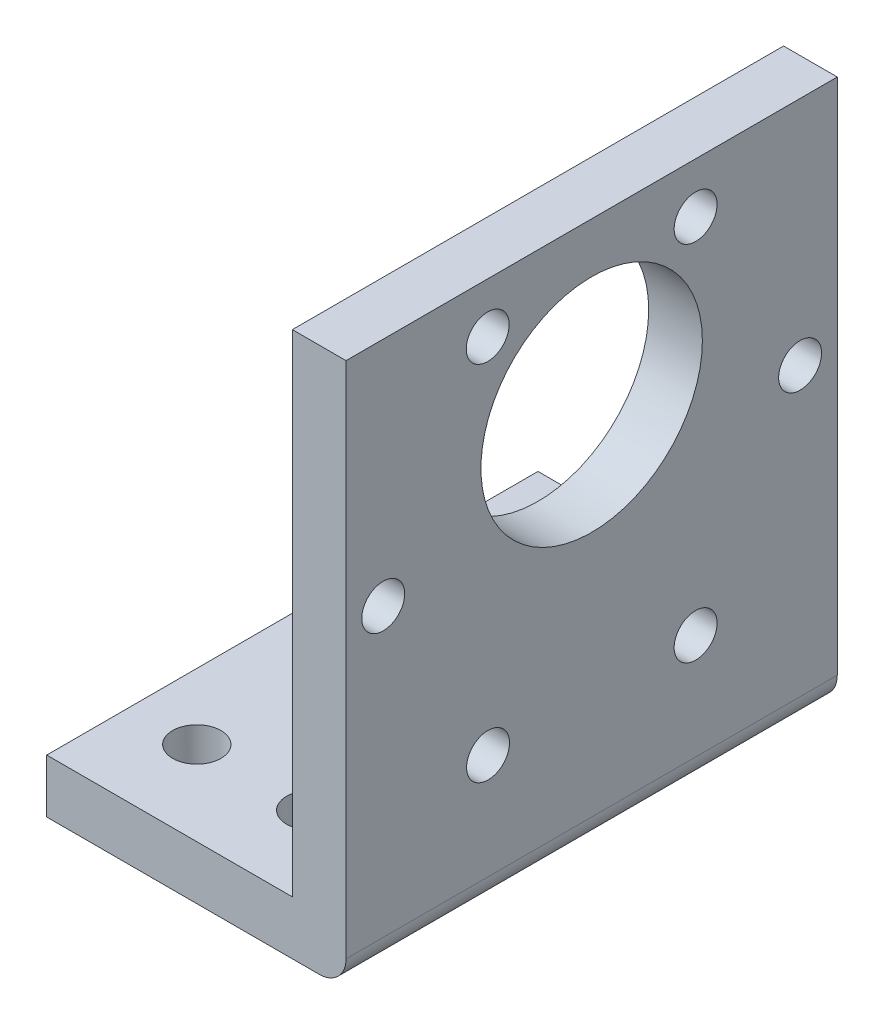
from build123d import *

# Parameters (mm, degrees)
SKETCH_1_W          = 22.3
SKETCH_1_H          = 36.6
EXTRUDE_1_DEPTH     = 40.6
SKETCH_2_W          = 18.3
SKETCH_2_H          = 36.6
CUT_EXTRUDE_1_DEPTH = 36.6
SKETCH_3_R          = 8.25
SKETCH_3_R_2        = 1.6
CUT_EXTRUDE_5_DEPTH = 36.6
SKETCH_4_R          = 1.8
CUT_EXTRUDE_7_DEPTH = 36.6
FILLET_1_R          = 2


with BuildPart() as part:
    # 草图1 → 凸台-拉伸1 (new body)
    with BuildSketch(Plane(origin=(0, 0, 0), x_dir=(1, 0, 0), z_dir=(0, 1, 0))):
        Rectangle(SKETCH_1_W, SKETCH_1_H)
    extrude(amount=EXTRUDE_1_DEPTH)

    # 草图2 → 切除-拉伸1 (cut)
    with BuildSketch(Plane(origin=(0, 40.6, 0), x_dir=(1, 0, 0), z_dir=(0, 1, 0))):
        with Locations((-2, 0)):
            Rectangle(SKETCH_2_W, SKETCH_2_H)
    extrude(amount=-CUT_EXTRUDE_1_DEPTH, mode=Mode.SUBTRACT)

    # 草图3 → 切除-拉伸5 (cut)
    with BuildSketch(Plane(origin=(11.15, 0, 0), x_dir=(0, 0, -1), z_dir=(1, 0, 0))):
        with Locations((0, 28.613666333)):
            Circle(SKETCH_3_R)
        with Locations((-7.745235234, 36.863666333)):
            Circle(SKETCH_3_R_2)
        with Locations((7.745235234, 36.863666333)):
            Circle(SKETCH_3_R_2)
        with Locations((-15.529977583, 23.38009706)):
            Circle(SKETCH_3_R_2)
        with Locations((15.529977583, 23.38009706)):
            Circle(SKETCH_3_R_2)
        with Locations((7.745235234, 9.85104245)):
            Circle(SKETCH_3_R_2)
        with Locations((-7.718974262, 9.85104245)):
            Circle(SKETCH_3_R_2)
    extrude(amount=-CUT_EXTRUDE_5_DEPTH, mode=Mode.SUBTRACT)

    # 草图4 → 切除-拉伸7 (cut)
    with BuildSketch(Plane(origin=(0, 0, 0), x_dir=(-1, 0, 0), z_dir=(0, -1, 0))):
        with Locations((-2.242650553, 12.027117887)):
            Circle(SKETCH_4_R)
        with Locations((6.242650553, 12.027117887)):
            Circle(SKETCH_4_R)
        with Locations((6.242650553, -12.027117887)):
            Circle(SKETCH_4_R)
        with Locations((-2.242650553, -12.027117887)):
            Circle(SKETCH_4_R)
    extrude(amount=-CUT_EXTRUDE_7_DEPTH, mode=Mode.SUBTRACT)

    # 圆角1
    fillet_1_edges = [part.edges().sort_by_distance(p)[0] for p in [
        (11.15, 0, 0),
    ]]
    fillet(fillet_1_edges, radius=FILLET_1_R)


solid = part.part
